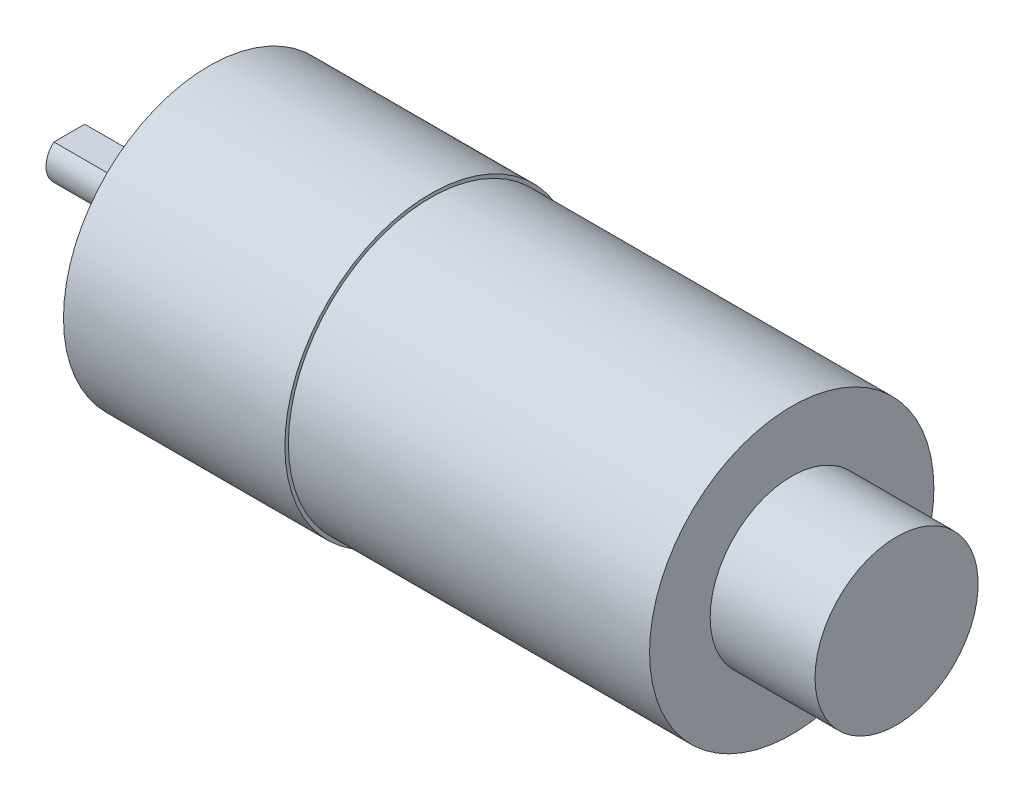
from build123d import *

# Parameters (mm, degrees)
SKETCH2_W          = 4
SKETCH2_H          = 0.5
CUT_EXTRUDE1_DEPTH = 8


with BuildPart() as part:
    # Sketch1 → Revolve1 (revolve)
    with BuildSketch(Plane.XY):
        Polygon((0, 3.5), (0, 2), (-9.5, 2), (-9.5, 0), (61.5, 0), (61.5, 7), (52.5, 7), (52.5, 12.2), (21.5, 12.2), (21.5, 12.5), (2.5, 12.5), (2.5, 3.5), align=None)
    revolve(axis=Axis((0, 0, 0), (1, 0, 0)))

    # Sketch2 → Cut-Extrude1 (cut)
    with BuildSketch(Plane.ZY.offset(9.5)):
        with Locations((0, 1.75)):
            Rectangle(SKETCH2_W, SKETCH2_H)
    extrude(amount=-CUT_EXTRUDE1_DEPTH, mode=Mode.SUBTRACT)


solid = part.part
